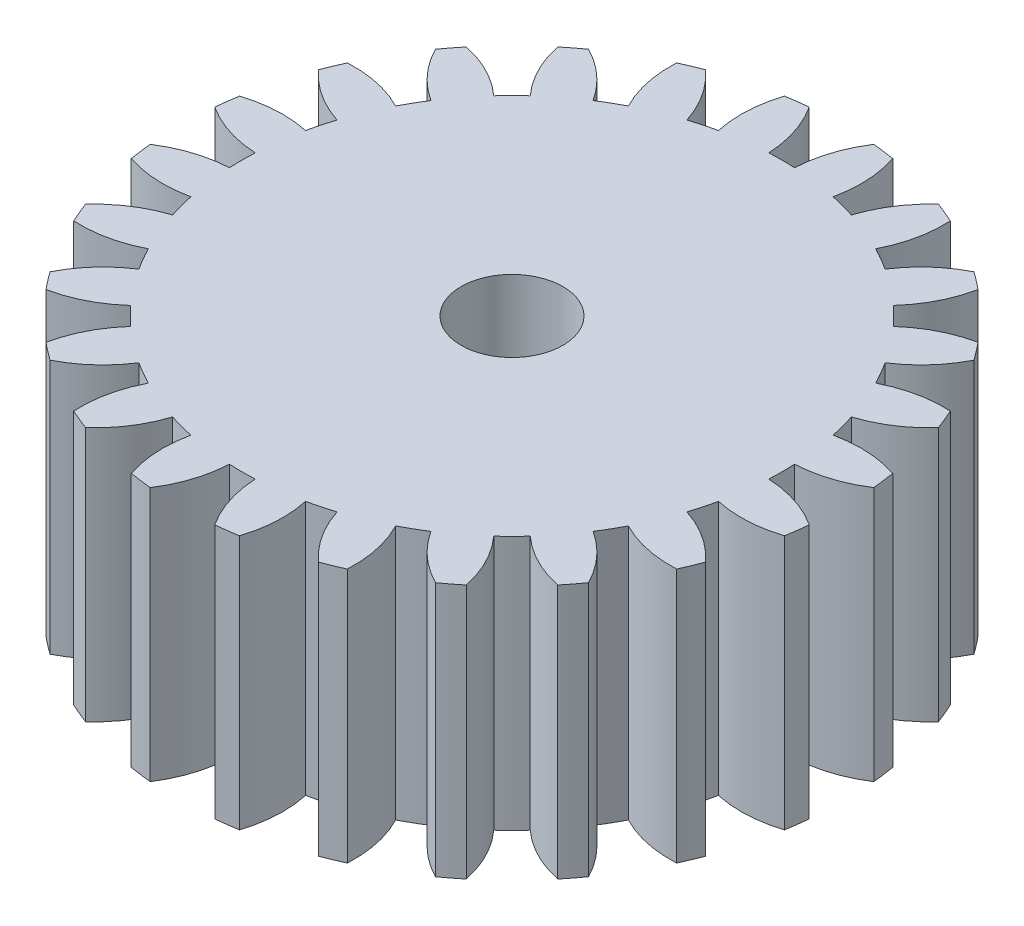
from build123d import *

# Parameters (mm, degrees)
SKETCH1_R               = 6.5
BOSS_EXTRUDE1_DEPTH     = 2.5
CUT_EXTRUDE1_DEPTH      = 10.526279442
CIRPATTERN1_COUNT       = 24
CUT_EXTRUDE2_DEPTH      = 10.48407185
CUT_EXTRUDE2_DEPTH_BACK = 10.48407185
SKETCH4_R               = 1


with BuildPart() as part:
    # Sketch1 → Boss-Extrude1 (new, symmetric)
    with BuildSketch(Plane(origin=(0, 0, 0), x_dir=(1, 0, 0), z_dir=(0, 1, 0))):
        Circle(SKETCH1_R)
    extrude(amount=BOSS_EXTRUDE1_DEPTH, both=True)

    # Sketch3 → Cut-Extrude1 (cut, symmetric)
    with BuildSketch(Plane(origin=(0, 0, 0), x_dir=(1, 0, 0), z_dir=(0, 1, 0))):
        with BuildLine():
            ThreePointArc((-2.097447593, 7.48155155), (-0.805034356, 6.699886195), (-0.253044756, 5.293955832))
            ThreePointArc((-0.253044756, 5.293955832), (0, 5.3), (0.253044756, 5.293955832))
            ThreePointArc((0.253044756, 5.293955832), (0.805034356, 6.699886195), (2.097447593, 7.48155155))
            ThreePointArc((2.097447593, 7.48155155), (0, 7.77), (-2.097447593, 7.48155155))
        make_face()
    cut_extrude1 = extrude(amount=CUT_EXTRUDE1_DEPTH, both=True, mode=Mode.SUBTRACT)

    # CirPattern1: Cut-Extrude1 ×24 about axis
    cirpattern1_axis = Axis((0, 2.5, 0), (0, 1, 0))
    for i in range(1, CIRPATTERN1_COUNT):
        add(cut_extrude1.rotate(cirpattern1_axis, i * 360 / CIRPATTERN1_COUNT), mode=Mode.SUBTRACT)

    # Sketch4 → Cut-Extrude2 (cut, two sides: drawn at the far end of the back side and taken through both)
    with BuildSketch(Plane(origin=(0, 0, 0), x_dir=(1, 0, 0), z_dir=(0, 1, 0)).offset(-CUT_EXTRUDE2_DEPTH_BACK)):
        Circle(SKETCH4_R)
    extrude(amount=CUT_EXTRUDE2_DEPTH + CUT_EXTRUDE2_DEPTH_BACK, mode=Mode.SUBTRACT)


solid = part.part
